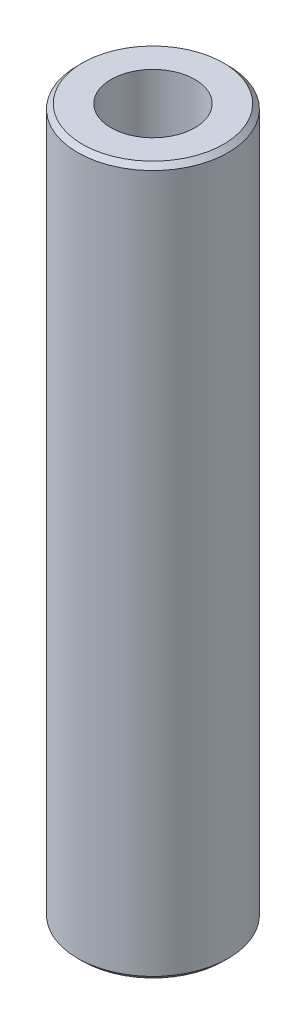
from build123d import *

# Parameters (mm, degrees)
SKETCH1_R           = 42.5
BOSS_EXTRUDE1_DEPTH = 399.1803784
SKETCH2_R           = 23.649532331
CUT_EXTRUDE1_DEPTH  = 404.679915898
CHAMFER1_SIZE       = 2.690831004


with BuildPart() as part:
    # Sketch1 → Boss-Extrude1 (new body)
    with BuildSketch(Plane(origin=(0, 0, 0), x_dir=(1, 0, 0), z_dir=(0, 1, 0))):
        Circle(SKETCH1_R)
    extrude(amount=BOSS_EXTRUDE1_DEPTH)

    # Sketch2 → Cut-Extrude1 (cut, through all)
    with BuildSketch(Plane(origin=(0, 0, 0), x_dir=(1, 0, 0), z_dir=(0, 1, 0))):
        Circle(SKETCH2_R)
    extrude(amount=CUT_EXTRUDE1_DEPTH, mode=Mode.SUBTRACT)

    # Chamfer1
    chamfer1_edges = [part.edges().sort_by_distance(p)[0] for p in [
        (-42.5, 399.1803784, 0),
        (-42.5, 0, 0),
    ]]
    chamfer(chamfer1_edges, length=CHAMFER1_SIZE)


solid = part.part
